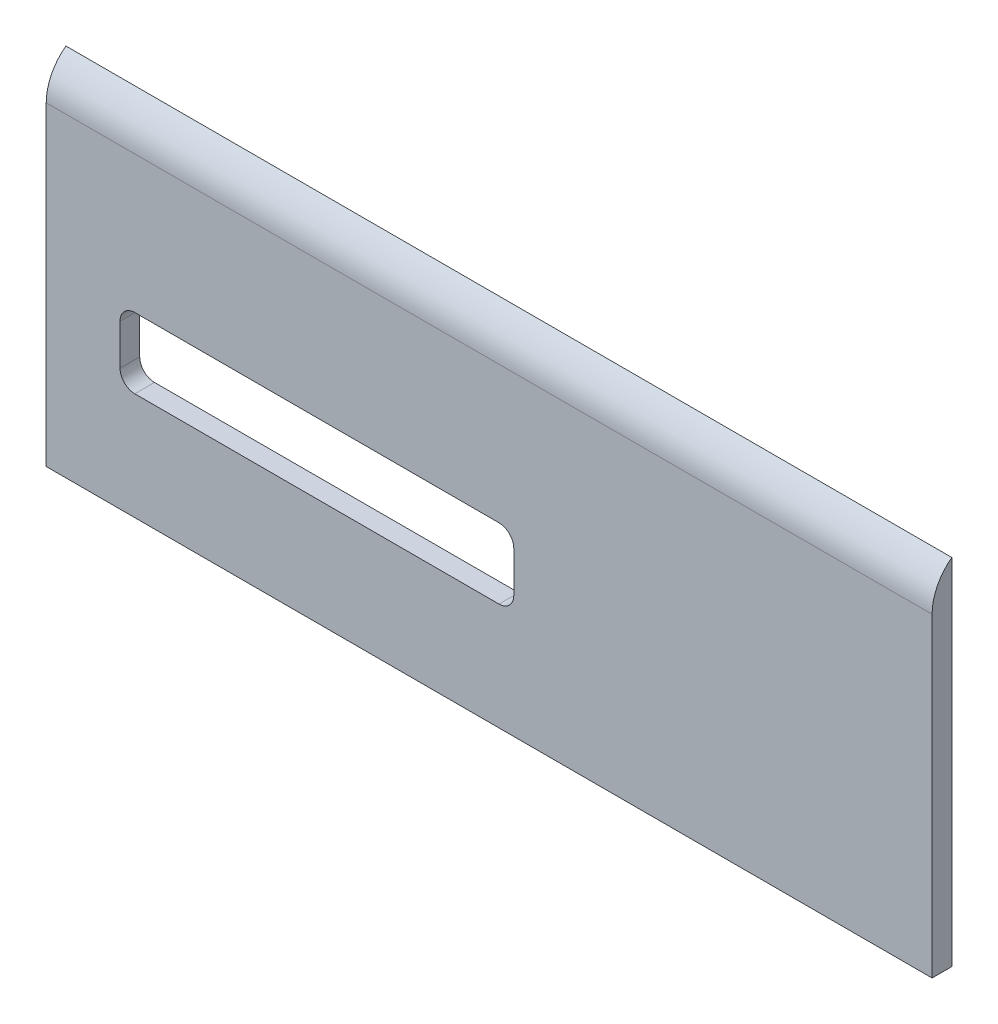
from build123d import *

# Parameters (mm, degrees)
SALIENTE_EXTRUIR1_DEPTH = 4
CROQUIS2_W              = 10
CROQUIS2_H              = 4
SALIENTE_EXTRUIR2_DEPTH = 10
CROQUIS3_R              = 1.5
CORTAR_EXTRUIR1_DEPTH   = 10
CROQUIS3_3_R            = 1.5
CORTAR_EXTRUIR2_DEPTH   = 1.65
REDONDEO2_R             = 10
CROQUIS4_W              = 4
CROQUIS4_H              = 72
CORTAR_EXTRUIR3_DEPTH   = 4
CORTAR_EXTRUIR4_REACH   = 118.859
CROQUIS5_W              = 80
CROQUIS5_H              = 14.3
REDONDEO3_R             = 3


with BuildPart() as part:
    # Croquis1 → Saliente-Extruir1 (new body)
    with BuildSketch(Plane.XY):
        with BuildLine():
            Line((-98, 60), (-98, -4))
            Line((-98, -4), (90, -4))
            Line((90, -4), (90, 60))
            ThreePointArc((90, 60), (88.94427191, 64.472135955), (86, 68))
            Line((86, 68), (-94, 68))
            ThreePointArc((-94, 68), (-96.94427191, 64.472135955), (-98, 60))
        make_face()
    extrude(amount=SALIENTE_EXTRUIR1_DEPTH)

    # Croquis2 → Saliente-Extruir2 (add)
    with BuildSketch(Plane(origin=(0, 0, 0), x_dir=(-1, 0, 0), z_dir=(0, 0, -1))):
        with Locations((46.991549296, 2)):
            Rectangle(CROQUIS2_W, CROQUIS2_H)
        with Locations((-38.991549296, 2)):
            Rectangle(CROQUIS2_W, CROQUIS2_H)
    extrude(amount=SALIENTE_EXTRUIR2_DEPTH)

    # Croquis3 → Cortar-Extruir1 (cut)
    with BuildSketch(Plane.XZ):
        with Locations((38.991549296, -5)):
            Circle(CROQUIS3_R)
        with Locations((-46.991549296, -5)):
            Circle(CROQUIS3_R)
    extrude(amount=-CORTAR_EXTRUIR1_DEPTH, mode=Mode.SUBTRACT)

    # Croquis3<3> → Cortar-Extruir2 (cut)
    # profile 1 of 2: a face of its own
    with BuildSketch(Plane.XZ):
        Polygon((-46.991549296, -8.175426481), (-44.241549296, -6.58771324), (-44.241549296, -3.41228676), (-46.991549296, -1.824573519), (-49.741549296, -3.41228676), (-49.741549296, -6.58771324), align=None)
        with Locations((-46.991549296, -5)):
            Circle(CROQUIS3_3_R, mode=Mode.SUBTRACT)
    # profile 2 of 2: a face of its own
    with BuildSketch(Plane.XZ):
        Polygon((38.991549296, -8.175426481), (41.741549296, -6.58771324), (41.741549296, -3.41228676), (38.991549296, -1.824573519), (36.241549296, -3.41228676), (36.241549296, -6.58771324), align=None)
        with Locations((38.991549296, -5)):
            Circle(CROQUIS3_3_R, mode=Mode.SUBTRACT)
    extrude(amount=-CORTAR_EXTRUIR2_DEPTH, mode=Mode.SUBTRACT)

    # Redondeo2
    # the kernel refuses this fillet: 10 mm, written as the material it takes off along each edge
    with BuildSketch(Plane(origin=(106, 68, 4), x_dir=(0, -1, 0), z_dir=(-1, 0, 0))) as redondeo2_piece_1:
        with BuildLine():
            CenterArc((8, -10), REDONDEO2_R, 90, 53.130102354)
            Line((0, -4), (-0.16, -3.88))
            ThreePointArc((-0.16, -3.88), (-0.2, -2), (-0.2, 0))
            Line((-0.2, 0), (0, 0.2))
            Line((0, 0.2), (8, 0.2))
            Line((8, 0.2), (8, 0))
        make_face()
    extrude(amount=220, mode=Mode.SUBTRACT)

    # Croquis4 → Cortar-Extruir3 (cut)
    with BuildSketch(Plane.XY.offset(4)):
        with Locations((88, 32)):
            Rectangle(CROQUIS4_W, CROQUIS4_H)
        with Locations((-96, 32)):
            Rectangle(CROQUIS4_W, CROQUIS4_H)
    extrude(amount=-CORTAR_EXTRUIR3_DEPTH, mode=Mode.SUBTRACT)

    # Croquis5 → Cortar-Extruir4 (cut, up to next)
    with BuildSketch(Plane.XY.offset(4), mode=Mode.PRIVATE) as cortar_extruir4_sk1:
        with Locations((-39, 24.95)):
            Rectangle(CROQUIS5_W, CROQUIS5_H)
    cortar_extruir4_tool1 = extrude(cortar_extruir4_sk1.sketch, amount=-CORTAR_EXTRUIR4_REACH, mode=Mode.PRIVATE) & part.part
    add(cortar_extruir4_tool1.solids().sort_by_distance((-39, 24.95, 4))[0], mode=Mode.SUBTRACT)

    # Redondeo3
    redondeo3_edges = [part.edges().sort_by_distance(p)[0] for p in [
        (-79, 17.8, 2),
        (-79, 32.1, 2),
        (1, 32.1, 2),
        (1, 17.8, 2),
    ]]
    fillet(redondeo3_edges, radius=REDONDEO3_R)


solid = part.part
